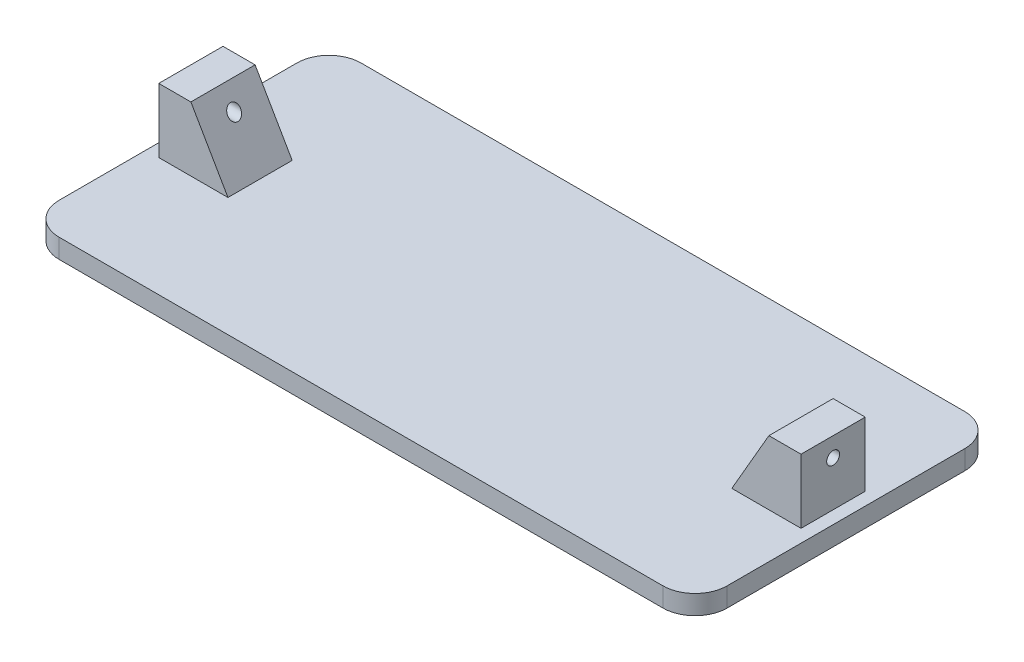
from build123d import *

# Parameters (mm, degrees)
EXTRUDE_1_DEPTH     = 3
EXTRUDE_2_DEPTH     = 5
SKETCH_4_R          = 1
CUT_EXTRUDE_1_DEPTH = 104.107953137
EXTRUDE_3_DEPTH     = 3


with BuildPart() as part:
    # Эскиз1 → Бобышка-Вытянуть1 (new body)
    with BuildSketch(Plane(origin=(0, 0, 0), x_dir=(1, 0, 0), z_dir=(0, 1, 0))):
        with BuildLine():
            Line((-45, -21.5), (45, -21.5))
            ThreePointArc((45, -21.5), (48.535533906, -20.035533906), (50, -16.5))
            Line((50, -16.5), (50, 16.5))
            ThreePointArc((50, 16.5), (48.535533906, 20.035533906), (45, 21.5))
            Line((45, 21.5), (-45, 21.5))
            ThreePointArc((-45, 21.5), (-48.535533906, 20.035533906), (-50, 16.5))
            Line((-50, 16.5), (-50, -16.5))
            ThreePointArc((-50, -16.5), (-48.535533906, -20.035533906), (-45, -21.5))
        make_face()
    extrude(amount=EXTRUDE_1_DEPTH)

    # Эскиз3 → Бобышка-Вытянуть2 (add, symmetric)
    with BuildSketch(Plane.XY):
        Polygon((-50, 3), (-39.226497308, 3), (-45, 13), (-50, 13), align=None)
        Polygon((39.226497308, 3), (50, 3), (50, 13), (45, 13), align=None)
    extrude(amount=EXTRUDE_2_DEPTH, both=True)

    # Эскиз4 → Вырез-Вытянуть1 (cut, through all)
    with BuildSketch(Plane.ZY.offset(50)):
        with Locations((0, 10)):
            Circle(SKETCH_4_R)
    extrude(amount=-CUT_EXTRUDE_1_DEPTH, mode=Mode.SUBTRACT)

    # Эскиз5 → Бобышка-Вытянуть3 (add)
    with BuildSketch(Plane.XZ):
        with BuildLine():
            Line((52, -18.5), (52, -16.5))
            Line((52, -16.5), (52, 16.5))
            Line((52, 16.5), (52, 18.5))
            ThreePointArc((52, 18.5), (50.535533906, 22.035533906), (47, 23.5))
            Line((47, 23.5), (45, 23.5))
            Line((45, 23.5), (-45, 23.5))
            Line((-45, 23.5), (-47, 23.5))
            ThreePointArc((-47, 23.5), (-50.535533906, 22.035533906), (-52, 18.5))
            Line((-52, 18.5), (-52, 16.5))
            Line((-52, 16.5), (-52, -16.5))
            Line((-52, -16.5), (-52, -18.5))
            ThreePointArc((-52, -18.5), (-50.535533906, -22.035533906), (-47, -23.5))
            Line((-47, -23.5), (-45, -23.5))
            Line((-45, -23.5), (45, -23.5))
            Line((45, -23.5), (47, -23.5))
            ThreePointArc((47, -23.5), (50.535533906, -22.035533906), (52, -18.5))
        make_face()
        with BuildLine():
            Line((50, 16.5), (50, -16.5))
            ThreePointArc((50, -16.5), (48.535533906, -20.035533906), (45, -21.5))
            Line((45, -21.5), (-45, -21.5))
            ThreePointArc((-45, -21.5), (-48.535533906, -20.035533906), (-50, -16.5))
            Line((-50, -16.5), (-50, 16.5))
            ThreePointArc((-50, 16.5), (-48.535533906, 20.035533906), (-45, 21.5))
            Line((-45, 21.5), (45, 21.5))
            ThreePointArc((45, 21.5), (48.535533906, 20.035533906), (50, 16.5))
        make_face(mode=Mode.SUBTRACT)
    extrude(amount=-EXTRUDE_3_DEPTH)


solid = part.part
